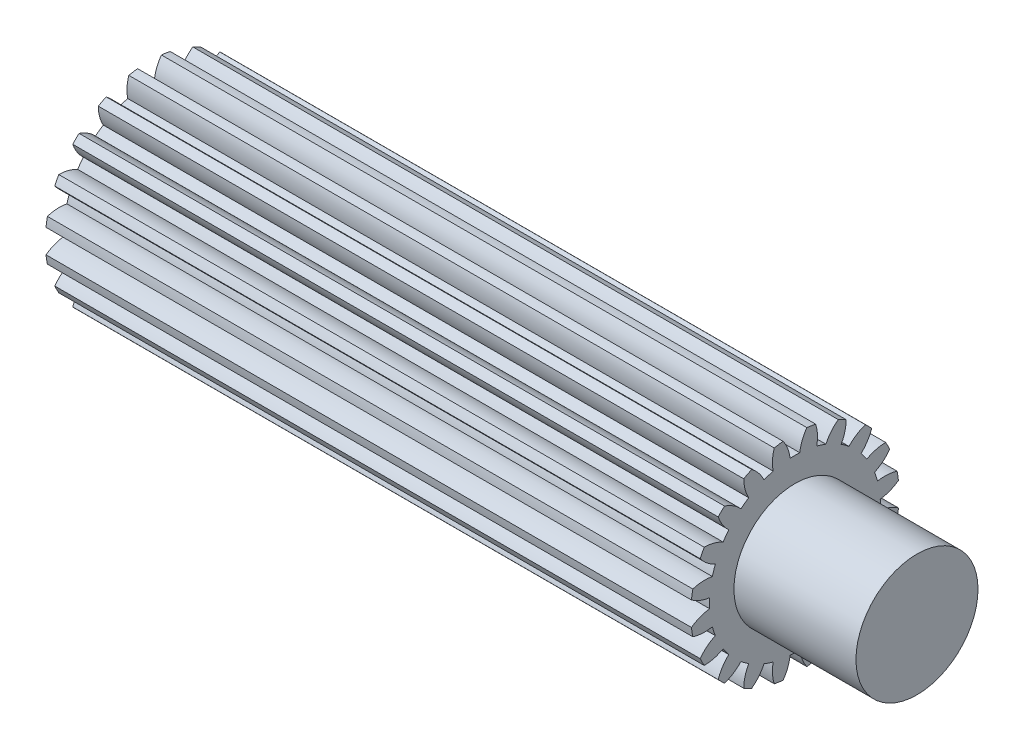
from build123d import *

# Parameters (mm, degrees)
BASPROSKE_W         = 132.2299391
BASPROSKE_H         = 22
TOOTHCUT_DEPTH      = 136.840924593
TEETHCUTS_COUNT     = 20
TEETHCUTS_ANGLE     = 342
BORSKE_R            = 0.4
BORE_DEPTH          = 50.0000508
SKETCH1_R           = 22
SKETCH1_R_2         = 21.342673338
CUT_EXTRUDE1_DEPTH  = 136.778456297
SCALE1_SCALE        = 0.4
SKETCH6_R           = 5
BOSS_EXTRUDE3_DEPTH = 10
CUT_EXTRUDE2_DEPTH  = 10


with BuildPart() as part:
    # BasProSke → Base-Revolve (revolve)
    with BuildSketch(Plane(origin=(0, 0, 0), x_dir=(1, 0, 0), z_dir=(0, 1, 0))):
        with Locations((66.11496955, 11)):
            Rectangle(BASPROSKE_W, BASPROSKE_H)
    revolve(axis=Axis((-10, 0, 0), (1, 0, 0)))

    # TooCutSke → ToothCut (cut, through all)
    with BuildSketch(Plane(origin=(0, 0, 0), x_dir=(0, 0, -1), z_dir=(1, 0, 0))):
        with BuildLine():
            ThreePointArc((0.986171591, 17.471189616), (0, 17.499), (-0.986171591, 17.471189616))
            ThreePointArc((-0.986171591, 17.471189616), (-1.626916196, 19.798789858), (-2.932850173, 21.829260982))
            ThreePointArc((-2.932850173, 21.829260982), (0, 22.0254), (2.932850173, 21.829260982))
            ThreePointArc((2.932850173, 21.829260982), (1.626916196, 19.798789858), (0.986171591, 17.471189616))
        make_face()
    toothcut = extrude(amount=TOOTHCUT_DEPTH, mode=Mode.SUBTRACT)

    # TeethCuts: ToothCut ×20 about axis
    teethcuts_axis = Axis((-10, 0, 0), (1, 0, 0))
    for i in range(1, TEETHCUTS_COUNT):
        add(toothcut.rotate(teethcuts_axis, i * TEETHCUTS_ANGLE / (TEETHCUTS_COUNT - 1)), mode=Mode.SUBTRACT)

    # BorSke → Bore (cut, symmetric)
    with BuildSketch(Plane(origin=(0, 0, 0), x_dir=(0, 0, -1), z_dir=(1, 0, 0))):
        Circle(BORSKE_R)
    extrude(amount=BORE_DEPTH, both=True, mode=Mode.SUBTRACT)

    # Sketch1 → Cut-Extrude1 (cut, through all)
    with BuildSketch(Plane(origin=(132.2299391, 0, 0), x_dir=(0, 0, -1), z_dir=(1, 0, 0))):
        Circle(SKETCH1_R)
        Circle(SKETCH1_R_2, mode=Mode.SUBTRACT)
    extrude(amount=-CUT_EXTRUDE1_DEPTH, mode=Mode.SUBTRACT)


with BuildPart() as part_1:
    # Scale1: scaled about (0, 0, 0)
    add(part.part.scale(SCALE1_SCALE))

    # Sketch6 → Boss-Extrude3 (add)
    with BuildSketch(Plane(origin=(52.89197564, 0, 0), x_dir=(0, 0, -1), z_dir=(1, 0, 0))):
        Circle(SKETCH6_R)
    extrude(amount=BOSS_EXTRUDE3_DEPTH)

    # Sketch7 → Cut-Extrude2 (cut)
    with BuildSketch(Plane.ZY):
        with BuildLine():
            Line((2.5, 0), (2.5, 4.330127019))
            ThreePointArc((2.5, 4.330127019), (-5, 0), (2.5, -4.330127019))
            Line((2.5, -4.330127019), (2.5, 0))
        make_face()
    extrude(amount=-CUT_EXTRUDE2_DEPTH, mode=Mode.SUBTRACT)


solid = part_1.part
